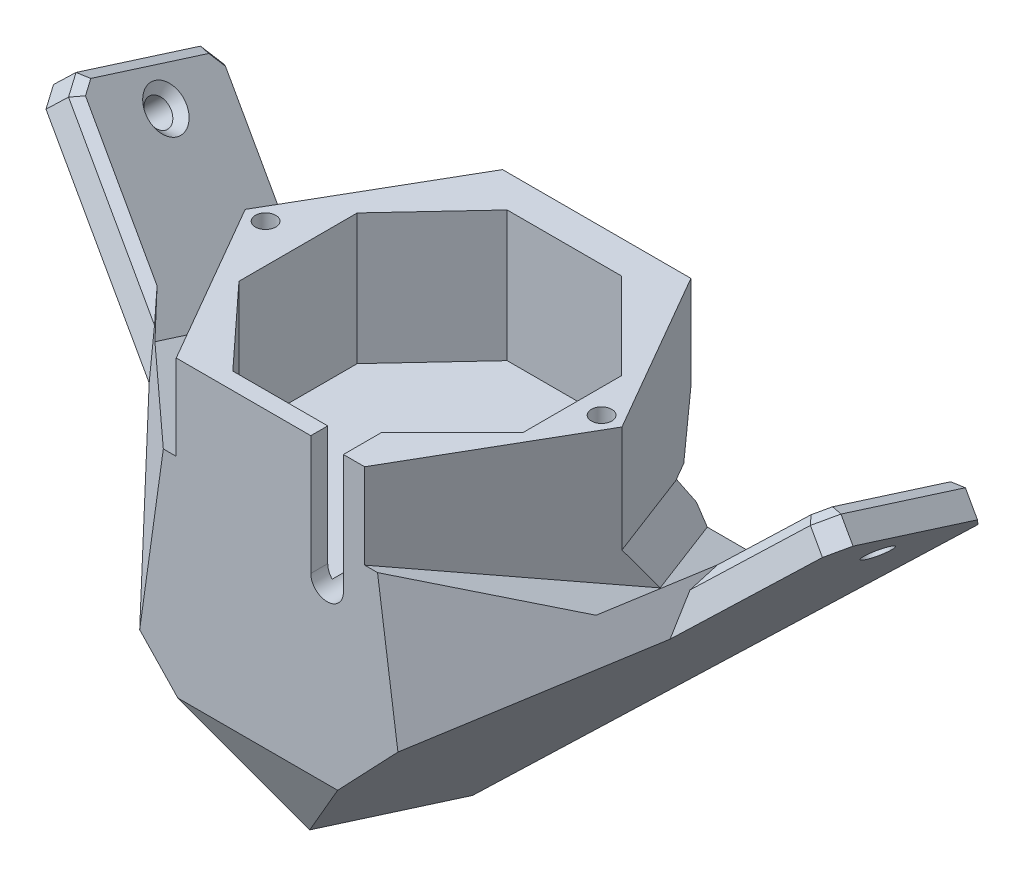
from build123d import *

# Parameters (mm, degrees)
BOSS_EXTRUDE3_DEPTH   = 1.9999999999999931
BOSS_EXTRUDE4_DEPTH   = 18.000000000000004
CUT_EXTRUDE2_DEPTH    = 5.9999999999999964
FILLET2_R             = 1
BOSS_EXTRUDE5_DEPTH   = 13.9
BOSS_EXTRUDE6_DEPTH   = 6.1
SKETCH9_R             = 76.29483757465395
CUT_EXTRUDE3_DEPTH    = 12.00000000000001
CHAMFER5_SIZE         = 15
CHAMFER5_SIZE_2       = 11.949844195
CHAMFER6_SIZE         = 26.289657229
CHAMFER6_SIZE_2       = 33
CHAMFER7_SIZE         = 10
CHAMFER7_SIZE_2       = 24.849963072
CHAMFER8_SIZE         = 3
CHAMFER8_SIZE2        = 3.581723532320745
CHAMFER8_EDGE_2_SIZE  = 3
CHAMFER8_EDGE_2_SIZE2 = 3.581723532320745
SKETCH10_R            = 1.250000000000001
SKETCH10_R_2          = 1.2500000000000047
CUT_EXTRUDE4_DEPTH    = 15
SKETCH11_R            = 1.6500000000000021
CUT_EXTRUDE5_DEPTH    = 10
SKETCH12_R            = 1.6500000000000021
CUT_EXTRUDE6_DEPTH    = 10
CHAMFER9_SIZE         = 2
CHAMFER10_SIZE        = 1
CHAMFER11_SIZE        = 1


with BuildPart() as part:
    # Sketch4 → Boss-Extrude3 (new body)
    # profile 1 of 2: a face of its own
    with BuildSketch(Plane(origin=(0, 0, 0), x_dir=(1, 0, 0), z_dir=(0, 1, 0))):
        Polygon((7.824132301685717, -0.6314167523101926), (30.918143069270773, -0.631416752310193), (42.46514845306328, 19.368583247689788), (30.918143069270762, 39.3685832476898), (7.824132301685726, 39.3685832476898), (-3.7228730821067892, 19.368583247689806), align=None)
        Polygon((3.519968483082529, 11.362456608232566), (3.519968483082529, 25.862456608232566), (12.388750416506909, 35.367439881093425), (26.38875041650691, 35.367439881093425), (36.99535213430513, 24.760838163295233), (36.99535213430513, 12.760838163295231), (25.681643635320377, 1.447129664310468), (12.681643635320377, 1.4471296643104665), align=None, mode=Mode.SUBTRACT)
    # profile 2 of 2: a face of its own
    with BuildSketch(Plane(origin=(0, 0, 0), x_dir=(1, 0, 0), z_dir=(0, 1, 0))):
        Polygon((3.519968483082529, 25.862456608232566), (12.388750416506909, 35.367439881093425), (26.38875041650691, 35.367439881093425), (36.99535213430513, 24.760838163295233), (36.99535213430513, 12.760838163295231), (25.681643635320377, 1.447129664310468), (12.681643635320377, 1.4471296643104665), (3.519968483082529, 11.362456608232566), align=None)
    extrude(amount=BOSS_EXTRUDE3_DEPTH)

    # Sketch4<3> → Boss-Extrude4 (add)
    with BuildSketch(Plane(origin=(0, 0, 0), x_dir=(1, 0, 0), z_dir=(0, 1, 0))):
        Polygon((42.46514845306328, 19.368583247689788), (30.918143069270762, 39.3685832476898), (7.824132301685726, 39.3685832476898), (-3.7228730821067892, 19.368583247689806), (7.824132301685717, -0.6314167523101926), (30.918143069270773, -0.631416752310193), align=None)
        Polygon((12.388750416506909, 35.367439881093425), (26.38875041650691, 35.367439881093425), (36.99535213430513, 24.760838163295233), (36.99535213430513, 12.760838163295231), (25.681643635320377, 1.447129664310468), (12.681643635320377, 1.4471296643104665), (3.519968483082529, 11.362456608232566), (3.519968483082529, 25.862456608232566), align=None, mode=Mode.SUBTRACT)
    extrude(amount=BOSS_EXTRUDE4_DEPTH)

    # Sketch6 → Cut-Extrude2 (cut)
    with BuildSketch(Plane.XY.offset(0.6314167523101925)):
        with BuildLine():
            Line((24.31779352067575, 3.376931571822402), (24.31779352067575, 18.000000000000004))
            ThreePointArc((24.31779352067575, 18.000000000000004), (26.317793520675753, 20), (28.31779352067575, 18.000000000000004))
            Line((28.31779352067575, 18.000000000000004), (28.31779352067575, 3.376931571822402))
            ThreePointArc((28.31779352067575, 3.376931571822402), (26.317793520675753, 1.3769315718223982), (24.31779352067575, 3.376931571822402))
        make_face()
    extrude(amount=-CUT_EXTRUDE2_DEPTH, mode=Mode.SUBTRACT)

    # Fillet2
    # the kernel refuses this fillet: 1 mm, written as the material it adds along each edge
    with BuildSketch(Plane(origin=(26.31779352067575, 3.3769315718223982, -5.368583247689804), x_dir=(0.8817842513635834, 0.4716529805345926, 0), z_dir=(-0.4716529805345926, 0.8817842513635834, 0))) as fillet2_piece_1_section:
        with BuildLine():
            CenterArc((2.000000000000001 - FILLET2_R, -FILLET2_R), FILLET2_R, 0, 90)
            Line((2.000000000000001 - FILLET2_R, 0), (2.000000000000001, 0))
            Line((2.000000000000001, 0), (2.000000000000001, -FILLET2_R))
        make_face()
    fillet2_piece_1 = revolve(axis=Axis((26.31779352067575, 3.3769315718223982, -5.368583247689804), (0, 0, -1)), revolution_arc=236.283297356719, mode=Mode.PRIVATE)
    fillet2_piece_1 = split(fillet2_piece_1, bisect_by=Plane(origin=(26.31779352067575, 1.9999999999999931, -5.368583247689804), z_dir=(0, -1, 0)), keep=Keep.TOP, mode=Mode.PRIVATE)
    add(fillet2_piece_1)

    # Sketch7 → Boss-Extrude5 (add)
    with BuildSketch(Plane(origin=(-2.3433e-13, -8.892992763494398, -28.081253619485487), x_dir=(-1, 2.4e-15, 7.58e-15), z_dir=(-7.955288143323601e-15, -0.30191008762919974, -0.9533364038930481))):
        Polygon((-17.816481796236683, -27.144355489981812), (-66.82257845064771, 21.861741164426753), (-63.9941513259015, 24.69016828917295), (-46.3164817962378, 7.012498759509267), (10.683518203762196, 7.01249875950926), (28.361187733425872, 24.690168289172963), (31.189614858172064, 21.861741164426775), align=None)
    extrude(amount=-BOSS_EXTRUDE5_DEPTH)

    # Sketch7<2> → Boss-Extrude6 (add)
    with BuildSketch(Plane(origin=(-2.3433e-13, -8.892992763494398, -28.081253619485487), x_dir=(-1, 2.4e-15, 7.58e-15), z_dir=(-7.955288143323601e-15, -0.30191008762919974, -0.9533364038930481))):
        Polygon((-17.816481796236683, -27.144355489981812), (-66.82257845064771, 21.861741164426753), (-63.9941513259015, 24.69016828917295), (-46.3164817962378, 7.012498759509267), (10.683518203762196, 7.01249875950926), (28.361187733425872, 24.690168289172963), (31.189614858172064, 21.861741164426775), align=None)
    extrude(amount=BOSS_EXTRUDE6_DEPTH)

    # Sketch9 → Cut-Extrude3 (cut)
    with BuildSketch(Plane(origin=(-2.4437e-13, -10.73464429803257, -33.896605683233126), x_dir=(-1, 2.08e-15, 6.55e-15), z_dir=(-6.8729633786059295e-15, -0.30191008762920085, -0.9533364038930477))):
        with Locations((-18.739928273786745, -5.029658831402463)):
            Circle(SKETCH9_R)
    extrude(amount=CUT_EXTRUDE3_DEPTH, mode=Mode.SUBTRACT)

    # Chamfer5
    # the kernel refuses this chamfer: 15, 11.949844195 mm, written as the material it adds along each edge
    with BuildSketch(Plane(origin=(-40.07039654949479, -6.7e-16, -23.227109814634193), x_dir=(0, -0.3019100876291997, -0.9533364038930482), z_dir=(1, 0, -4.1e-16))) as chamfer5_piece_1_section:
        Polygon((CHAMFER5_SIZE, -1.7e-16), (CHAMFER5_SIZE_2 * 0.953336403892, CHAMFER5_SIZE_2 * 0.301910087629), (0, 0), align=None)
    chamfer5_piece_1 = extrude(amount=118.88306846994604, mode=Mode.PRIVATE)
    chamfer5_piece_1 = split(chamfer5_piece_1, bisect_by=Plane(origin=(-11.138962934878297, -6.7e-16, -6.523538829193566), z_dir=(0.8660254037844386, 0, 0.5000000000000002)), keep=Keep.TOP, mode=Mode.PRIVATE)
    chamfer5_piece_1 = split(chamfer5_piece_1, bisect_by=Plane(origin=(20.160471188348254, -6.7e-16, -58.0014175166026), z_dir=(-0.8660254037844387, 0, 0.49999999999999983)), keep=Keep.TOP, mode=Mode.PRIVATE)
    chamfer5_piece_1 = split(chamfer5_piece_1, bisect_by=Plane(origin=(-40.070396549494895, -4.049373948337407, -36.01374979821588), z_dir=(7.955288143323603e-15, 0.3019100876291998, 0.9533364038930482)), keep=Keep.TOP, mode=Mode.PRIVATE)
    add(chamfer5_piece_1)

    # Chamfer6
    # the kernel refuses this chamfer: 33, 26.289657229 mm, written as the material it adds along each edge
    with BuildSketch(Plane(origin=(-86.82668553862769, 6e-17, -16.317184053181116), x_dir=(8.34e-15, 0, 1), z_dir=(1, 0, -8.34e-15))) as chamfer6_piece_1_section:
        Polygon((CHAMFER6_SIZE, 0), (CHAMFER6_SIZE_2 * 0.301910087629, CHAMFER6_SIZE_2 * 0.953336403893), (0, 0), align=None)
    chamfer6_piece_1 = extrude(amount=212.3956464482121, mode=Mode.PRIVATE)
    chamfer6_piece_1 = split(chamfer6_piece_1, bisect_by=Plane(origin=(8.820895345374609, 6e-17, 38.90497251753413), z_dir=(-0.8660254037844387, 0, -0.5000000000000001)), keep=Keep.TOP, mode=Mode.PRIVATE)
    chamfer6_piece_1 = split(chamfer6_piece_1, bisect_by=Plane(origin=(-86.82668553862769, 6e-17, 0.6314167523101908), z_dir=(2e-17, 0, -1)), keep=Keep.TOP, mode=Mode.PRIVATE)
    chamfer6_piece_1 = split(chamfer6_piece_1, bisect_by=Plane(origin=(-23.17753158647104, 6e-17, -53.06504022115066), z_dir=(0.8660254037844388, 0, -0.49999999999999967)), keep=Keep.TOP, mode=Mode.PRIVATE)
    chamfer6_piece_1 = split(chamfer6_piece_1, bisect_by=Plane(origin=(-18.469762892528394, -65.16714281663096, 4.320460452965666), z_dir=(-0.70710678118653, 0.6741106359447901, -0.213482670271232)), keep=Keep.TOP, mode=Mode.PRIVATE)
    chamfer6_piece_1 = split(chamfer6_piece_1, bisect_by=Plane(origin=(-50.54044084986548, 34.5929980223678, -27.27236736690021), z_dir=(0.7071067811865465, 0.6741106359447712, -0.21348267027123768)), keep=Keep.TOP, mode=Mode.PRIVATE)
    add(chamfer6_piece_1)

    # Chamfer7
    # the kernel refuses this chamfer: 24.849963072, 10 mm, written as the material it adds along each edge
    with BuildSketch(Plane(origin=(-13.402538260860302, 62.57603192906444, -36.134255137466226), x_dir=(-0.985146022817089, -0.16370569293011733, 0.051843609345241695), z_dir=(0.17171870523525357, -0.9391755667020143, 0.29742552207616374))) as chamfer7_piece_1_section:
        Polygon((CHAMFER7_SIZE, 0), (-CHAMFER7_SIZE_2 * 0.47666820195, -CHAMFER7_SIZE_2 * 0.879083286874), (0, 0), align=None)
    chamfer7_piece_1 = extrude(amount=146.25239464157488, mode=Mode.PRIVATE)
    chamfer7_piece_1 = split(chamfer7_piece_1, bisect_by=Plane(origin=(-13.402538260860302, 62.57603192906444, 0.6314167523100025), z_dir=(0, 0, -1)), keep=Keep.TOP, mode=Mode.PRIVATE)
    chamfer7_piece_1 = split(chamfer7_piece_1, bisect_by=Plane(origin=(-13.402538260860295, 1.9888278042485794, -16.94702172034867), z_dir=(0, -0.9533364038930481, 0.3019100876291998)), keep=Keep.TOP, mode=Mode.PRIVATE)
    chamfer7_piece_1 = split(chamfer7_piece_1, bisect_by=Plane(origin=(-46.64785866937016, 30.88205772455304, -26.09715753968952), z_dir=(0.7071067811866999, 0.674110635944714, -0.21348267027090945)), keep=Keep.TOP, mode=Mode.PRIVATE)
    add(chamfer7_piece_1)
    with BuildSketch(Plane(origin=(-13.402538260860302, 62.57603192906444, -36.134255137466226), x_dir=(-0.985146022817089, -0.16370569293011733, 0.051843609345241695), z_dir=(0.17171870523525357, -0.9391755667020143, 0.29742552207616374))) as chamfer7_piece_2_section:
        Polygon((CHAMFER7_SIZE, 0), (-CHAMFER7_SIZE_2 * 0.47666820195, -CHAMFER7_SIZE_2 * 0.879083286874), (0, 0), align=None)
    chamfer7_piece_2 = extrude(amount=146.25239464157488, mode=Mode.PRIVATE)
    chamfer7_piece_2 = split(chamfer7_piece_2, bisect_by=Plane(origin=(-43.819431544616265, 33.57850026833004, -26.951088220759228), z_dir=(-0.7071067811865481, -0.6741106359447696, 0.2134826702712372)), keep=Keep.TOP, mode=Mode.PRIVATE)
    chamfer7_piece_2 = split(chamfer7_piece_2, bisect_by=Plane(origin=(1.116959507238203, 62.57603192906444, -27.751419192552138), z_dir=(-0.866025403784329, 0, -0.50000000000019)), keep=Keep.TOP, mode=Mode.PRIVATE)
    chamfer7_piece_2 = split(chamfer7_piece_2, bisect_by=Plane(origin=(-46.64785866937016, 30.88205772455304, -26.09715753968952), z_dir=(0.7071067811866999, 0.674110635944714, -0.21348267027090945)), keep=Keep.TOP, mode=Mode.PRIVATE)
    add(chamfer7_piece_2)
    with BuildSketch(Plane(origin=(40.70342230672514, 1.421e-14, -16.317184053181006), x_dir=(-0.46958778335124995, 0.34343741046908505, 0.8133498993775979), z_dir=(-0.17171870523460778, -0.9391755667021419, 0.29742552207613376))) as chamfer7_piece_3_section:
        Polygon((CHAMFER7_SIZE_2, 5e-17), (-CHAMFER7_SIZE * 0.476668201947, -CHAMFER7_SIZE * 0.879083286869), (0, 0), align=None)
    chamfer7_piece_3 = extrude(amount=75.8012281617361, mode=Mode.PRIVATE)
    chamfer7_piece_3 = split(chamfer7_piece_3, bisect_by=Plane(origin=(40.70342230672514, 1.421e-14, 0.6314167523099989), z_dir=(0, 0, -1)), keep=Keep.TOP, mode=Mode.PRIVATE)
    chamfer7_piece_3 = split(chamfer7_piece_3, bisect_by=Plane(origin=(45.29529103013723, -4.37759561592531, -14.930852564516274), z_dir=(-0.7071067811866999, 0.674110635944714, -0.21348267027090945)), keep=Keep.TOP, mode=Mode.PRIVATE)
    add(chamfer7_piece_3)
    with BuildSketch(Plane(origin=(40.703422306709314, 0, -16.317184053182185), x_dir=(-0.4695877833507219, 0.3434374104692333, 0.8133498993778403), z_dir=(0.17171870523461666, 0.9391755667020876, -0.29742552207629974))) as chamfer7_piece_4_section:
        Polygon((CHAMFER7_SIZE_2, -1.39e-15), (-CHAMFER7_SIZE * 0.476668201946, CHAMFER7_SIZE * 0.87908328687), (0, 0), align=None)
    chamfer7_piece_4 = extrude(amount=66.6286838666467, mode=Mode.PRIVATE)
    chamfer7_piece_4 = split(chamfer7_piece_4, bisect_by=Plane(origin=(40.703422306709314, 0, 0.6314167523099989), z_dir=(0, 0, -1)), keep=Keep.TOP, mode=Mode.PRIVATE)
    chamfer7_piece_4 = split(chamfer7_piece_4, bisect_by=Plane(origin=(40.703422306709314, 1.9888278042464063, -16.94702172035553), z_dir=(0, -0.9533364038930481, 0.3019100876291998)), keep=Keep.TOP, mode=Mode.PRIVATE)
    chamfer7_piece_4 = split(chamfer7_piece_4, bisect_by=Plane(origin=(45.29529103012948, -4.377595615933028, -14.930852564515012), z_dir=(-0.7071067811866999, 0.674110635944714, -0.21348267027090945)), keep=Keep.TOP, mode=Mode.PRIVATE)
    add(chamfer7_piece_4)
    with BuildSketch(Plane(origin=(40.703422306709314, 0, -16.317184053182185), x_dir=(-0.4695877833507219, 0.3434374104692333, 0.8133498993778403), z_dir=(0.17171870523461666, 0.9391755667020876, -0.29742552207629974))) as chamfer7_piece_5_section:
        Polygon((CHAMFER7_SIZE_2, -1.39e-15), (-CHAMFER7_SIZE * 0.476668201946, CHAMFER7_SIZE * 0.87908328687), (0, 0), align=None)
    chamfer7_piece_5 = extrude(amount=66.6286838666467, mode=Mode.PRIVATE)
    chamfer7_piece_5 = split(chamfer7_piece_5, bisect_by=Plane(origin=(42.46686390539787, -1.6811530721691632, -15.78478324559316), z_dir=(0.7071067811865476, -0.6741106359447736, 0.21348267027122672)), keep=Keep.TOP, mode=Mode.PRIVATE)
    chamfer7_piece_5 = split(chamfer7_piece_5, bisect_by=Plane(origin=(45.29529103012948, -4.377595615933028, -14.930852564515012), z_dir=(-0.7071067811866999, 0.674110635944714, -0.21348267027090945)), keep=Keep.TOP, mode=Mode.PRIVATE)
    add(chamfer7_piece_5)

    # Chamfer8
    chamfer8_edges = [part.edges().sort_by_distance(p)[0] for p in [
        (37.66010275874009, -1.413712668985988, -27.691166522953175),
    ]]
    chamfer8_side = [part.faces().sort_by_distance(p)[0] for p in [
        (39.11811662501184, 5.412102651204146, -6.137404334709689),
    ]]
    chamfer(chamfer8_edges, length=CHAMFER8_SIZE, length2=CHAMFER8_SIZE2, reference=chamfer8_side[0])

    # Chamfer8 edge 2
    chamfer8_edge_2_edges = [part.edges().sort_by_distance(p)[0] for p in [
        (1.082172612223939, -1.413712668985995, -27.691166522953186),
    ]]
    chamfer8_edge_2_side = [part.faces().sort_by_distance(p)[0] for p in [
        (-3.753441987426493, 0.3224095092149044, -22.209042732119624),
    ]]
    chamfer(chamfer8_edge_2_edges, length=CHAMFER8_EDGE_2_SIZE, length2=CHAMFER8_EDGE_2_SIZE2, reference=chamfer8_edge_2_side[0])

    # Sketch10 → Cut-Extrude4 (cut)
    with BuildSketch(Plane(origin=(0, 19.000000000000004, 0), x_dir=(1, 0, 0), z_dir=(0, 1, 0))):
        with Locations(Location((-1.222873082106972, 19.36858324769008, 0), (0, 0, 180))):
            Circle(SKETCH10_R)
        with Locations(Location((39.96514845306313, 19.36858324769008, 0), (0, 0, 180))):
            Circle(SKETCH10_R_2)
    extrude(amount=-CUT_EXTRUDE4_DEPTH, mode=Mode.SUBTRACT)

    # Sketch11 → Cut-Extrude5 (cut)
    with BuildSketch(Plane(origin=(35.32201665467818, -41.86992335687557, -3.057486659815476), x_dir=(0.7071067811865472, -0.6741106359447733, 0.21348267027122825), z_dir=(0.7071067811865479, 0.6741106359447697, -0.21348267027123718))):
        with Locations(Location((-85.06165134103477, 9.999999999999932, 0), (0, 0, 192.622135028))):
            Circle(SKETCH11_R)
    extrude(amount=-CUT_EXTRUDE5_DEPTH, mode=Mode.SUBTRACT)

    # Sketch12 → Cut-Extrude6 (cut)
    with BuildSketch(Plane(origin=(0.6719496880472284, -41.525766293156714, -3.166477031777557), x_dir=(0.7071067811865476, 0.6741106359447698, -0.21348267027123732), z_dir=(-0.7071067811865476, 0.6741106359447735, -0.21348267027122664))):
        with Locations(Location((84.55111635557729, 10.000000000000021, 0), (0, 0, 167.377864972))):
            Circle(SKETCH12_R)
    extrude(amount=-CUT_EXTRUDE6_DEPTH, mode=Mode.SUBTRACT)

    # Chamfer9
    chamfer9_edges = [part.edges().sort_by_distance(p)[0] for p in [
        (65.40836488827448, 17.49337243097609, -21.857123136594044),
        (-29.775401295799092, 17.493372430976333, -21.857123136593327),
        (-29.775401295799252, 11.455170678392335, -40.923851214454295),
        (65.40836488827432, 11.455170678392093, -40.92385121445501),
    ]]
    chamfer(chamfer9_edges, length=CHAMFER9_SIZE)

    # Chamfer10
    chamfer10_edges = [part.edges().sort_by_distance(p)[0] for p in [
        (54.448209779882745, 3.702898365027181, -38.46880050633574),
        (57.416239101908474, 12.57063051812014, -20.298150421173567),
        (-23.687124594014378, 11.257682059679667, -30.7500391646968),
        (63.9941513259013, 15.822492826574202, -31.817452516065217),
        (63.28704454471424, 12.431191401966615, -40.18399748083003),
        (63.28704454471484, 17.86557297929168, -23.023942210758307),
        (-18.815246187407773, 3.70289836502743, -38.46880050633521),
        (-28.361187733426075, 15.82249282657436, -31.817452516064762),
        (-19.900423737640644, 10.775639380936056, -19.729698477758326),
        (-27.65408095223878, 12.431191401967412, -40.18399748083),
        (-27.654080952242666, 17.865572979288856, -23.02394221075666),
    ]]
    chamfer(chamfer10_edges, length=CHAMFER10_SIZE)

    # Chamfer11
    chamfer11_edges = [part.edges().sort_by_distance(p)[0] for p in [
        (61.59714665344764, 13.646197234020015, -30.7500391647242),
    ]]
    chamfer(chamfer11_edges, length=CHAMFER11_SIZE)


solid = part.part
